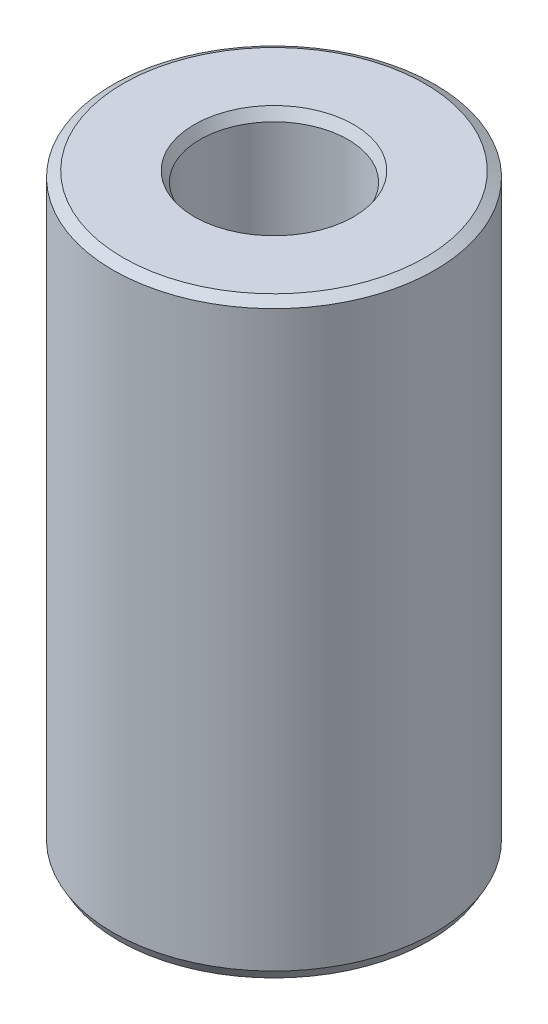
from build123d import *
from OCP.BRepFilletAPI import BRepFilletAPI_MakeChamfer

# Parameters (mm, degrees)
SKETCH1_R           = 55
BOSS_EXTRUDE1_DEPTH = 201.543631725
SKETCH2_R           = 25.305755523
CUT_EXTRUDE1_DEPTH  = 217.032024221
CHAMFER1_SIZE       = 1.97963582
CHAMFER1_SIZE2      = 3.42882982


with BuildPart() as part:
    # Sketch1 → Boss-Extrude1 (new body)
    with BuildSketch(Plane(origin=(0, 0, 0), x_dir=(1, 0, 0), z_dir=(0, 1, 0))):
        Circle(SKETCH1_R)
    extrude(amount=BOSS_EXTRUDE1_DEPTH)

    # Sketch2 → Cut-Extrude1 (cut, through all)
    with BuildSketch(Plane(origin=(0, 0, 0), x_dir=(1, 0, 0), z_dir=(0, 1, 0))):
        Circle(SKETCH2_R)
    extrude(amount=CUT_EXTRUDE1_DEPTH, mode=Mode.SUBTRACT)

    # Chamfer1: one chamfer whose edges measure the first distance from different faces: ONE call of the kernel's chamfer builder (chamfer() names one face for all edges)
    chamfer1_edges_1 = [part.edges().sort_by_distance(p)[0] for p in [
        (-25.305755523, 201.543631725, 0),
    ]]
    chamfer1_side_1 = [part.faces().sort_by_distance(p)[0] for p in [
        (-53.444365081, 201.543631725, 0),
    ]]
    chamfer1_edges_2 = [part.edges().sort_by_distance(p)[0] for p in [
        (-25.305755523, 0, 0),
    ]]
    chamfer1_side_2 = [part.faces().sort_by_distance(p)[0] for p in [
        (-25.305755523, 100.771815863, 0),
    ]]
    chamfer1_edges_3 = [part.edges().sort_by_distance(p)[0] for p in [
        (-55, 0, 0),
    ]]
    chamfer1_side_3 = [part.faces().sort_by_distance(p)[0] for p in [
        (-53.444365081, 0, 0),
    ]]
    chamfer1_edges_4 = [part.edges().sort_by_distance(p)[0] for p in [
        (-55, 201.543631725, 0),
    ]]
    chamfer1_side_4 = [part.faces().sort_by_distance(p)[0] for p in [
        (-55, 100.771815863, 0),
    ]]
    chamfer1 = BRepFilletAPI_MakeChamfer(part.part.solid().wrapped)
    for e in chamfer1_edges_1:
        chamfer1.Add(CHAMFER1_SIZE, CHAMFER1_SIZE2, e.wrapped, chamfer1_side_1[0].wrapped)  # the first distance lies on this face
    for e in chamfer1_edges_2:
        chamfer1.Add(CHAMFER1_SIZE, CHAMFER1_SIZE2, e.wrapped, chamfer1_side_2[0].wrapped)  # the first distance lies on this face
    for e in chamfer1_edges_3:
        chamfer1.Add(CHAMFER1_SIZE, CHAMFER1_SIZE2, e.wrapped, chamfer1_side_3[0].wrapped)  # the first distance lies on this face
    for e in chamfer1_edges_4:
        chamfer1.Add(CHAMFER1_SIZE, CHAMFER1_SIZE2, e.wrapped, chamfer1_side_4[0].wrapped)  # the first distance lies on this face
    add(Compound.cast(chamfer1.Shape()), mode=Mode.REPLACE)


solid = part.part
